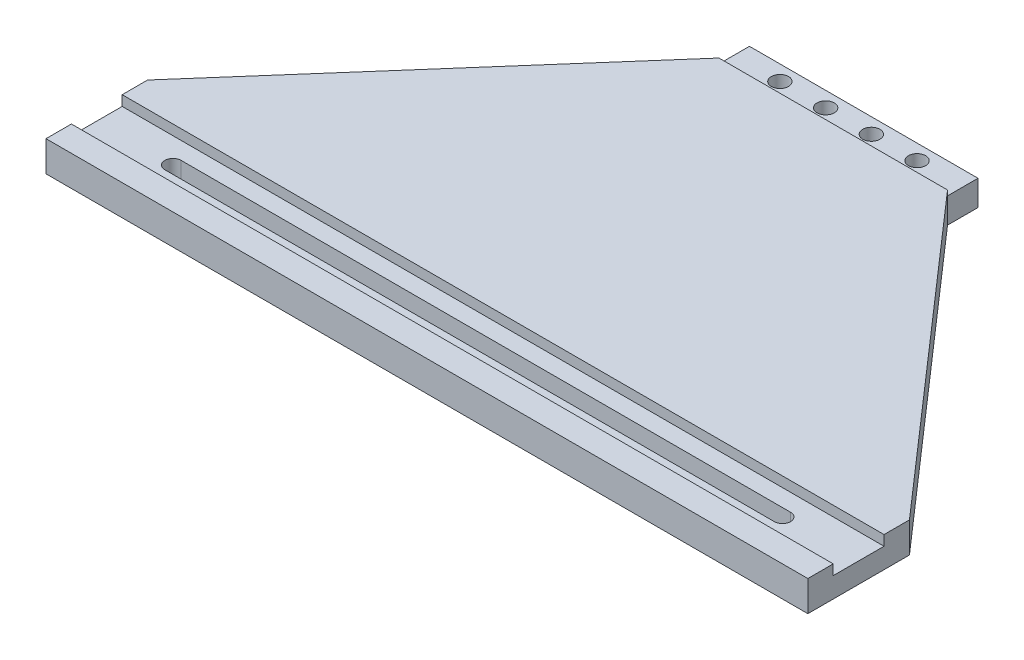
from build123d import *

# Parameters (mm, degrees)
EXTRUDE_1_DEPTH     = 6
SKETCH_2_W          = 150
SKETCH_2_H          = 10
CUT_EXTRUDE_1_DEPTH = 2
SKETCH_3_W          = 45
SKETCH_3_H          = 6
CUT_EXTRUDE_2_DEPTH = 1
HOLE_WIZARD_M31_D   = 3.4
CUT_EXTRUDE_3_DEPTH = 112.937482552


with BuildPart() as part:
    # Эскиз1 → Бобышка-Вытянуть1 (new body)
    with BuildSketch(Plane(origin=(0, 0, 0), x_dir=(1, 0, 0), z_dir=(0, 1, 0))):
        Polygon((-22.5, 3), (22.5, 3), (22.5, -3), (75, -63), (75, -83), (-75, -83), (-75, -63), (-22.5, -3), align=None)
    extrude(amount=EXTRUDE_1_DEPTH)

    # Эскиз2 → Вырез-Вытянуть1 (cut)
    with BuildSketch(Plane(origin=(0, 6, 0), x_dir=(1, 0, 0), z_dir=(0, 1, 0))):
        with Locations((0, -73)):
            Rectangle(SKETCH_2_W, SKETCH_2_H)
    extrude(amount=-CUT_EXTRUDE_1_DEPTH, mode=Mode.SUBTRACT)

    # Эскиз3 → Вырез-Вытянуть2 (cut)
    with BuildSketch(Plane(origin=(0, 6, 0), x_dir=(1, 0, 0), z_dir=(0, 1, 0))):
        Rectangle(SKETCH_3_W, SKETCH_3_H)
    extrude(amount=-CUT_EXTRUDE_2_DEPTH, mode=Mode.SUBTRACT)

    # Отверстие с зазором M31 (through all)
    with Locations(Plane(origin=(0, 0, 0), x_dir=(-1, 0, 0), z_dir=(0, -1, 0))):
        with Locations((-13.5, 0), (-4.5, 0), (4.5, 0), (13.5, 0)):
            Hole(HOLE_WIZARD_M31_D / 2)

    # Эскиз9 → Вырез-Вытянуть3 (cut, through all)
    with BuildSketch(Plane(origin=(0, 4, 0), x_dir=(1, 0, 0), z_dir=(0, 1, 0))):
        with BuildLine():
            Line((-60, -71.4), (60, -71.4))
            ThreePointArc((60, -71.4), (61.6, -73), (60, -74.6))
            Line((60, -74.6), (-60, -74.6))
            ThreePointArc((-60, -74.6), (-61.6, -73), (-60, -71.4))
        make_face()
    extrude(amount=-CUT_EXTRUDE_3_DEPTH, mode=Mode.SUBTRACT)


solid = part.part
